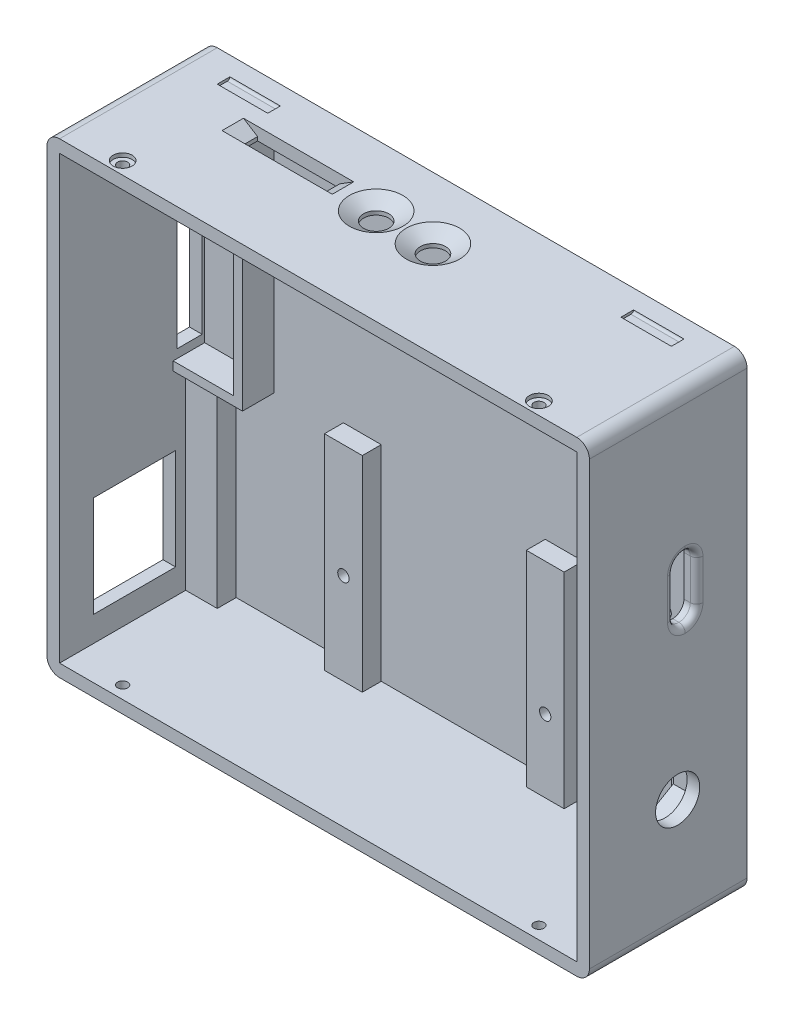
from build123d import *
from OCP.BRepFilletAPI import BRepFilletAPI_MakeChamfer

# Parameters (mm, degrees)
SKETCH1_W           = 86
SKETCH1_H           = 74
BOSS_EXTRUDE1_DEPTH = 25
SKETCH3_W           = 82
SKETCH3_H           = 70
CUT_EXTRUDE1_DEPTH  = 23
SKETCH4_W           = 8
SKETCH4_H           = 37.5
SKETCH4_W_2         = 1.4
BOSS_EXTRUDE2_DEPTH = 5
SKETCH5_W           = 3
SKETCH5_H           = 8
SKETCH5_W_2         = 1
SKETCH5_H_2         = 4
CUT_EXTRUDE2_DEPTH  = 2
SKETCH6_R           = 1
CUT_EXTRUDE3_DEPTH  = 5
SKETCH7_W           = 4
SKETCH7_H           = 35
CUT_EXTRUDE4_DEPTH  = 5
SKETCH9_W           = 5
SKETCH9_H           = 32.5
SKETCH9_W_2         = 6
BOSS_EXTRUDE3_DEPTH = 3
SKETCH10_R          = 0.9
CUT_EXTRUDE6_DEPTH  = 4
FILLET1_R           = 2
SKETCH13_R          = 2
SKETCH13_W          = 13
SKETCH13_H          = 3.4
CUT_EXTRUDE9_DEPTH  = 4
CHAMFER1_SIZE       = 1.4
CHAMFER1_SIZE2      = 2.240468341
SKETCH14_R          = 0.8
CUT_EXTRUDE10_DEPTH = 76
SKETCH15_R          = 1.5
CUT_EXTRUDE11_DEPTH = 0.6
CUT_EXTRUDE12_START = -0.6
SKETCH16_R          = 1.5
CUT_EXTRUDE12_DEPTH = 0.6
SKETCH20_W          = 11
SKETCH20_H          = 1.4
BOSS_EXTRUDE6_DEPTH = 5
SKETCH21_W          = 13
SKETCH21_H          = 16
CUT_EXTRUDE13_DEPTH = 10
SKETCH22_W          = 3
SKETCH22_H          = 12
BOSS_EXTRUDE7_DEPTH = 12
CUT_EXTRUDE14_DEPTH = 3
SKETCH24_R          = 3.5
CUT_EXTRUDE15_DEPTH = 3
FILLET2_R           = 3
SKETCH27_W          = 3.6
SKETCH27_H          = 10
CUT_EXTRUDE16_DEPTH = 3
FILLET3_R           = 1.8
FILLET4_R           = 1
FILLET5_R           = 2
SKETCH28_W          = 8
SKETCH28_H          = 2
CUT_EXTRUDE17_DEPTH = 0.4
SKETCH29_W          = 8
SKETCH29_H          = 2
CUT_EXTRUDE18_DEPTH = 0.4
FILLET6_R           = 0.4


with BuildPart() as part:
    # Sketch1 → Boss-Extrude1 (new body)
    with BuildSketch(Plane.XY):
        with Locations((43, 37)):
            Rectangle(SKETCH1_W, SKETCH1_H)
    extrude(amount=BOSS_EXTRUDE1_DEPTH)

    # Sketch3 → Cut-Extrude1 (cut)
    with BuildSketch(Plane.XY.offset(25)):
        with Locations((43, 37)):
            Rectangle(SKETCH3_W, SKETCH3_H)
    extrude(amount=-CUT_EXTRUDE1_DEPTH, mode=Mode.SUBTRACT)

    # Sketch4 → Boss-Extrude2 (add)
    with BuildSketch(Plane.XY.offset(2)):
        with Locations((80, 53.25)):
            Rectangle(SKETCH4_W, SKETCH4_H)
        with Locations((12.3, 53.25)):
            Rectangle(SKETCH4_W_2, SKETCH4_H)
    extrude(amount=BOSS_EXTRUDE2_DEPTH)

    # Sketch5 → Cut-Extrude2 (cut)
    with BuildSketch(Plane.XY.offset(7)):
        with Locations((77.5, 58)):
            Rectangle(SKETCH5_W, SKETCH5_H)
        with Locations((76.5, 43.5)):
            Rectangle(SKETCH5_W_2, SKETCH5_H_2)
    extrude(amount=-CUT_EXTRUDE2_DEPTH, mode=Mode.SUBTRACT)

    # Sketch6 → Cut-Extrude3 (cut)
    with BuildSketch(Plane.XY.offset(7)):
        with Locations((80, 67.25)):
            Circle(SKETCH6_R)
        with Locations((80, 39.25)):
            Circle(SKETCH6_R)
    extrude(amount=-CUT_EXTRUDE3_DEPTH, mode=Mode.SUBTRACT)

    # Sketch7 → Cut-Extrude4 (cut)
    with BuildSketch(Plane(origin=(2, 0, 0), x_dir=(0, 0, -1), z_dir=(1, 0, 0))):
        with Locations((-4.4, 53.35)):
            Rectangle(SKETCH7_W, SKETCH7_H)
    extrude(amount=-CUT_EXTRUDE4_DEPTH, mode=Mode.SUBTRACT)

    # Sketch9 → Boss-Extrude3 (add)
    with BuildSketch(Plane.XY.offset(2)):
        with Locations((81.5, 18.25)):
            Rectangle(SKETCH9_W, SKETCH9_H)
        with Locations((59, 18.25)):
            Rectangle(SKETCH9_W_2, SKETCH9_H)
        with Locations((4.5, 18.25)):
            Rectangle(SKETCH9_W, SKETCH9_H)
        with Locations((27, 18.25)):
            Rectangle(SKETCH9_W_2, SKETCH9_H)
    extrude(amount=BOSS_EXTRUDE3_DEPTH)

    # Sketch10 → Cut-Extrude6 (cut)
    with BuildSketch(Plane.XY.offset(5)):
        with Locations((59, 13.5)):
            Circle(SKETCH10_R)
        with Locations((27, 16.5)):
            Circle(SKETCH10_R)
    extrude(amount=-CUT_EXTRUDE6_DEPTH, mode=Mode.SUBTRACT)

    # Fillet1
    fillet1_edges = [part.edges().sort_by_distance(p)[0] for p in [
        (0, 74, 12.5),
        (86, 74, 12.5),
        (86, 0, 12.5),
        (0, 0, 12.5),
    ]]
    fillet(fillet1_edges, radius=FILLET1_R)

    # Sketch13 → Cut-Extrude9 (cut)
    with BuildSketch(Plane(origin=(0, 72, 0), x_dir=(-1, 0, 0), z_dir=(0, -1, 0))):
        with Locations(Location((-37, -9.8, 0), (0, 0, 90))):
            Circle(SKETCH13_R)
        with Locations(Location((-46, -9.8, 0), (0, 0, 90))):
            Circle(SKETCH13_R)
        with Locations((-22.5, -9.3)):
            Rectangle(SKETCH13_W, SKETCH13_H)
    extrude(amount=-CUT_EXTRUDE9_DEPTH, mode=Mode.SUBTRACT)

    # Chamfer1: one chamfer whose edges measure the first distance from different faces: ONE call of the kernel's chamfer builder (chamfer() names one face for all edges)
    chamfer1_edges_1 = [part.edges().sort_by_distance(p)[0] for p in [
        (16, 74, 9.3),
    ]]
    chamfer1_side_1 = [part.faces().sort_by_distance(p)[0] for p in [
        (16, 73, 9.3),
    ]]
    chamfer1_edges_2 = [part.edges().sort_by_distance(p)[0] for p in [
        (29, 74, 9.3),
    ]]
    chamfer1_side_2 = [part.faces().sort_by_distance(p)[0] for p in [
        (29, 73, 9.3),
    ]]
    chamfer1_edges_3 = [part.edges().sort_by_distance(p)[0] for p in [
        (37, 74, 11.8),
    ]]
    chamfer1_side_3 = [part.faces().sort_by_distance(p)[0] for p in [
        (37, 73, 11.8),
    ]]
    chamfer1_edges_4 = [part.edges().sort_by_distance(p)[0] for p in [
        (46, 74, 11.8),
    ]]
    chamfer1_side_4 = [part.faces().sort_by_distance(p)[0] for p in [
        (46, 73, 11.8),
    ]]
    chamfer1 = BRepFilletAPI_MakeChamfer(part.part.solid().wrapped)
    for e in chamfer1_edges_1:
        chamfer1.Add(CHAMFER1_SIZE, CHAMFER1_SIZE2, e.wrapped, chamfer1_side_1[0].wrapped)  # the first distance lies on this face
    for e in chamfer1_edges_2:
        chamfer1.Add(CHAMFER1_SIZE, CHAMFER1_SIZE2, e.wrapped, chamfer1_side_2[0].wrapped)  # the first distance lies on this face
    for e in chamfer1_edges_3:
        chamfer1.Add(CHAMFER1_SIZE, CHAMFER1_SIZE2, e.wrapped, chamfer1_side_3[0].wrapped)  # the first distance lies on this face
    for e in chamfer1_edges_4:
        chamfer1.Add(CHAMFER1_SIZE, CHAMFER1_SIZE2, e.wrapped, chamfer1_side_4[0].wrapped)  # the first distance lies on this face
    add(Compound.cast(chamfer1.Shape()), mode=Mode.REPLACE)

    # Sketch14 → Cut-Extrude10 (cut)
    with BuildSketch(Plane(origin=(0, 0, 0), x_dir=(-1, 0, 0), z_dir=(0, -1, 0))):
        with Locations(Location((-10, -23, 0), (0, 0, 90))):
            Circle(SKETCH14_R)
        with Locations(Location((-76, -23, 0), (0, 0, 90))):
            Circle(SKETCH14_R)
    extrude(amount=-CUT_EXTRUDE10_DEPTH, mode=Mode.SUBTRACT)

    # Sketch15 → Cut-Extrude11 (cut)
    with BuildSketch(Plane(origin=(0, 0, 0), x_dir=(-1, 0, 0), z_dir=(0, -1, 0))):
        with Locations(Location((-10, -23, 0), (0, 0, 90))):
            Circle(SKETCH15_R)
        with Locations(Location((-76, -23, 0), (0, 0, 90))):
            Circle(SKETCH15_R)
    extrude(amount=-CUT_EXTRUDE11_DEPTH, mode=Mode.SUBTRACT)

    # Sketch16 → Cut-Extrude12 (cut)
    with BuildSketch(Plane(origin=(0, 74, 0), x_dir=(1, 0, 0), z_dir=(0, 1, 0)).offset(CUT_EXTRUDE12_START)):
        with Locations(Location((76, -23, 0), (0, 0, 90))):
            Circle(SKETCH16_R)
        with Locations(Location((10, -23, 0), (0, 0, 90))):
            Circle(SKETCH16_R)
    extrude(amount=CUT_EXTRUDE12_DEPTH, mode=Mode.SUBTRACT)

    # Sketch20 → Boss-Extrude6 (add)
    with BuildSketch(Plane.XY.offset(2)):
        with Locations((7.5, 33.8)):
            Rectangle(SKETCH20_W, SKETCH20_H)
    extrude(amount=BOSS_EXTRUDE6_DEPTH)

    # Sketch21 → Cut-Extrude13 (cut)
    with BuildSketch(Plane(origin=(2, 0, 0), x_dir=(0, 0, -1), z_dir=(1, 0, 0))):
        with Locations((-13.1, 14)):
            Rectangle(SKETCH21_W, SKETCH21_H)
    extrude(amount=-CUT_EXTRUDE13_DEPTH, mode=Mode.SUBTRACT)

    # Sketch22 → Boss-Extrude7 (add)
    with BuildSketch(Plane.XY.offset(5)):
        with Locations((82.5, 18.25)):
            Rectangle(SKETCH22_W, SKETCH22_H)
    extrude(amount=BOSS_EXTRUDE7_DEPTH)

    # Sketch23 → Cut-Extrude14 (cut)
    with BuildSketch(Plane.ZY.offset(-81)):
        Polygon((6.7, 15.767393842), (11, 13.284787685), (15.3, 15.767393842), (15.3, 20.732606158), (11, 23.215212315), (6.7, 20.732606158), align=None)
    extrude(amount=-CUT_EXTRUDE14_DEPTH, mode=Mode.SUBTRACT)

    # Sketch24 → Cut-Extrude15 (cut)
    with BuildSketch(Plane.ZY.offset(-84)):
        with Locations((11, 18.25)):
            Circle(SKETCH24_R)
    extrude(amount=-CUT_EXTRUDE15_DEPTH, mode=Mode.SUBTRACT)

    # Fillet2
    fillet2_edges = [part.edges().sort_by_distance(p)[0] for p in [
        (82.5, 24.25, 5),
        (82.5, 12.25, 5),
        (82.5, 24.25, 17),
        (82.5, 12.25, 17),
    ]]
    fillet(fillet2_edges, radius=FILLET2_R)

    # Sketch27 → Cut-Extrude16 (cut)
    with BuildSketch(Plane.ZY.offset(-84)):
        with Locations((9.8, 46.5)):
            Rectangle(SKETCH27_W, SKETCH27_H)
    extrude(amount=-CUT_EXTRUDE16_DEPTH, mode=Mode.SUBTRACT)

    # Fillet3
    fillet3_edges = [part.edges().sort_by_distance(p)[0] for p in [
        (85, 41.5, 8),
        (85, 41.5, 11.6),
        (85, 51.5, 8),
        (85, 51.5, 11.6),
    ]]
    fillet(fillet3_edges, radius=FILLET3_R - 0.0001)  # a hair under: the kernel refuses the full size

    # Fillet4
    fillet4_edges = [part.edges().sort_by_distance(p)[0] for p in [
        (86, 46.5, 8),
        (86, 46.5, 11.6),
        (86, 42.027178505, 8.527178505),
        (86, 42.027178505, 11.072821495),
        (86, 50.972821495, 8.527178505),
        (86, 50.972821495, 11.072821495),
    ]]
    fillet(fillet4_edges, radius=FILLET4_R)

    # Fillet5
    fillet5_edges = [part.edges().sort_by_distance(p)[0] for p in [
        (84, 5.625, 5),
        (84, 11.371320344, 5.878679656),
        (84, 12.25, 11),
        (84, 13.128679656, 16.121320344),
        (84, 30.875, 5),
        (84, 25.128679656, 5.878679656),
        (84, 24.25, 11),
        (84, 23.371320344, 16.121320344),
        (84, 18.25, 17),
    ]]
    fillet(fillet5_edges, radius=FILLET5_R)

    # Sketch28 → Cut-Extrude17 (cut)
    with BuildSketch(Plane(origin=(0, 0, 0), x_dir=(-1, 0, 0), z_dir=(0, -1, 0))):
        with Locations((-11, -4)):
            Rectangle(SKETCH28_W, SKETCH28_H)
        with Locations((-75, -4)):
            Rectangle(SKETCH28_W, SKETCH28_H)
    extrude(amount=-CUT_EXTRUDE17_DEPTH, mode=Mode.SUBTRACT)

    # Sketch29 → Cut-Extrude18 (cut)
    with BuildSketch(Plane(origin=(0, 74, 0), x_dir=(1, 0, 0), z_dir=(0, 1, 0))):
        with Locations((75, -4)):
            Rectangle(SKETCH29_W, SKETCH29_H)
        with Locations((11, -4)):
            Rectangle(SKETCH29_W, SKETCH29_H)
    extrude(amount=-CUT_EXTRUDE18_DEPTH, mode=Mode.SUBTRACT)

    # Fillet6
    fillet6_edges = [part.edges().sort_by_distance(p)[0] for p in [
        (75, 0.4, 5),
        (75, 0.4, 3),
        (11, 0.4, 3),
        (11, 0.4, 5),
        (11, 73.6, 5),
        (11, 73.6, 3),
        (75, 73.6, 3),
        (75, 73.6, 5),
    ]]
    fillet(fillet6_edges, radius=FILLET6_R - 0.0001)  # a hair under: the kernel refuses the full size


solid = part.part
